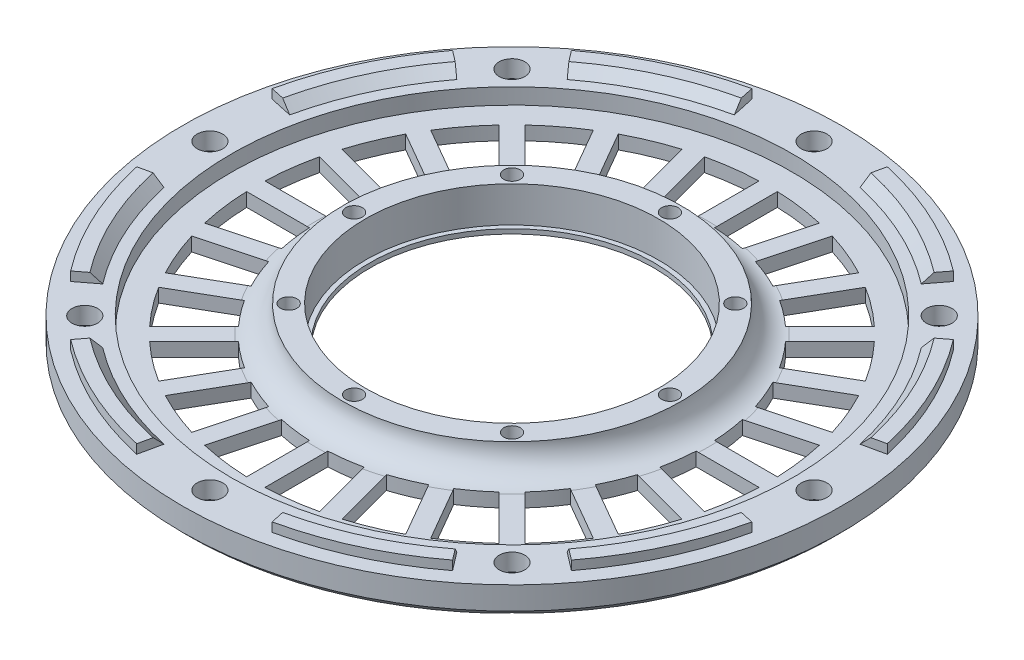
from build123d import *

# Parameters (mm, degrees)
SKETCH1_R                                         = 36
SKETCH1_R_2                                       = 16.025
BOSS_EXTRUDE1_DEPTH                               = 1
SKETCH2_R                                         = 18.5
SKETCH2_R_2                                       = 16.025
BOSS_EXTRUDE2_DEPTH                               = 3.9
FILLET1_R                                         = 2.9
BOSS_EXTRUDE3_START                               = -0.5
SKETCH4_R                                         = 36
SKETCH4_R_2                                       = 15.525
BOSS_EXTRUDE3_DEPTH                               = 0.5
CUT_EXTRUDE1_DEPTH                                = 51.994215358
CUT_EXTRUDE1_DEPTH_BACK                           = 51.994215358
SKETCH7_R                                         = 0.9
CUT_EXTRUDE2_DEPTH                                = 52.101467698
SKETCH8_R                                         = 36
SKETCH8_R_2                                       = 30.65
BOSS_EXTRUDE4_DEPTH                               = 1.7378
BOSS_EXTRUDE5_DEPTH                               = 1
CIRPATTERN1_COUNT                                 = 4
CHAMFER1_SIZE                                     = 1
CUT_EXTRUDE3_DEPTH                                = 52.014540569
CUT_EXTRUDE3_DEPTH_BACK                           = 52.014540569
SKETCH10_R                                        = 1.4
CHAMFER2_SIZE                                     = 0.75
CSK_FOR_M2_5_FLAT_HEAD_MACHINE_SCREW1_D           = 2.7
CSK_FOR_M2_5_FLAT_HEAD_MACHINE_SCREW1_CSINK_D     = 5.5
CSK_FOR_M2_5_FLAT_HEAD_MACHINE_SCREW1_CSINK_ANGLE = 90


with BuildPart() as part:
    # Sketch1 → Boss-Extrude1 (new body)
    with BuildSketch(Plane(origin=(0, 0, 0), x_dir=(1, 0, 0), z_dir=(0, 1, 0))):
        with Locations(Location((0, 0, 0), (0, 0, 270))):
            Circle(SKETCH1_R)
        with Locations(Location((0, 0, 0), (0, 0, 270))):
            Circle(SKETCH1_R_2, mode=Mode.SUBTRACT)
    extrude(amount=BOSS_EXTRUDE1_DEPTH)

    # Sketch2 → Boss-Extrude2 (add)
    with BuildSketch(Plane.XZ):
        with Locations(Location((0, 0, 0), (0, 0, 270))):
            Circle(SKETCH2_R)
        with Locations(Location((0, 0, 0), (0, 0, 90))):
            Circle(SKETCH2_R_2, mode=Mode.SUBTRACT)
    extrude(amount=-BOSS_EXTRUDE2_DEPTH)

    # Fillet1
    fillet1_edges = [part.edges().sort_by_distance(p)[0] for p in [
        (0, 1, 18.5),
    ]]
    fillet(fillet1_edges, radius=FILLET1_R - 0.0001)  # a hair under: the kernel refuses the full size

    # Sketch4 → Boss-Extrude3 (add)
    with BuildSketch(Plane(origin=(0, 0, 0), x_dir=(1, 0, 0), z_dir=(0, 1, 0)).offset(BOSS_EXTRUDE3_START)):
        with Locations(Location((0, 0, 0), (0, 0, 270))):
            Circle(SKETCH4_R)
        with Locations(Location((0, 0, 0), (0, 0, 270))):
            Circle(SKETCH4_R_2, mode=Mode.SUBTRACT)
    extrude(amount=BOSS_EXTRUDE3_DEPTH)

    # Sketch5 → Cut-Extrude1 (cut, two sides: drawn at the far end of the back side and taken through both)
    with BuildSketch(Plane(origin=(0, 1, 0), x_dir=(1, 0, 0), z_dir=(0, 1, 0)).offset(-CUT_EXTRUDE1_DEPTH_BACK)):
        with BuildLine():
            Line((27.989953555, 1), (21.126346111, 1))
            ThreePointArc((21.126346111, 1), (20.969058818, 2.760628965), (20.665302369, 4.501974901))
            Line((20.665302369, 4.501974901), (27.29503806, 6.278407225))
            ThreePointArc((27.29503806, 6.278407225), (27.768200701, 3.655752976), (27.989953555, 1))
        make_face()
        with BuildLine():
            Line((27.989953555, -1), (21.126346111, -1))
            ThreePointArc((21.126346111, -1), (20.969058818, -2.760628965), (20.665302369, -4.501974901))
            Line((20.665302369, -4.501974901), (27.29503806, -6.278407225))
            ThreePointArc((27.29503806, -6.278407225), (27.768200701, -3.655752976), (27.989953555, -1))
        make_face()
        with BuildLine():
            Line((26.77739997, -8.210258878), (20.147664279, -6.433826553))
            ThreePointArc((20.147664279, -6.433826553), (19.540052113, -8.093754595), (18.795952421, -9.697147652))
            Line((18.795952421, -9.697147652), (24.740010829, -13.128951374))
            ThreePointArc((24.740010829, -13.128951374), (25.875843712, -10.718125404), (26.77739997, -8.210258878))
        make_face()
        with BuildLine():
            Line((23.740010829, -14.861002181), (17.795952421, -11.429198459))
            ThreePointArc((17.795952421, -11.429198459), (16.779423147, -12.875304224), (15.645689378, -14.231475816))
            Line((15.645689378, -14.231475816), (20.498992745, -19.084779183))
            ThreePointArc((20.498992745, -19.084779183), (22.220090737, -17.050075298), (23.740010829, -14.861002181))
        make_face()
        with BuildLine():
            Line((19.084779183, -20.498992745), (14.231475816, -15.645689378))
            ThreePointArc((14.231475816, -15.645689378), (12.875304224, -16.779423147), (11.429198459, -17.795952421))
            Line((11.429198459, -17.795952421), (14.861002181, -23.740010829))
            ThreePointArc((14.861002181, -23.740010829), (17.050075298, -22.220090737), (19.084779183, -20.498992745))
        make_face()
        with BuildLine():
            Line((13.128951374, -24.740010829), (9.697147652, -18.795952421))
            ThreePointArc((9.697147652, -18.795952421), (8.093754595, -19.540052113), (6.433826553, -20.147664279))
            Line((6.433826553, -20.147664279), (8.210258878, -26.77739997))
            ThreePointArc((8.210258878, -26.77739997), (10.718125404, -25.875843712), (13.128951374, -24.740010829))
        make_face()
        with BuildLine():
            Line((6.278407225, -27.29503806), (4.501974901, -20.665302369))
            ThreePointArc((4.501974901, -20.665302369), (2.760628965, -20.969058818), (1, -21.126346111))
            Line((1, -21.126346111), (1, -27.989953555))
            ThreePointArc((1, -27.989953555), (3.655752976, -27.768200701), (6.278407225, -27.29503806))
        make_face()
        with BuildLine():
            Line((-1, -27.989953555), (-1, -21.126346111))
            ThreePointArc((-1, -21.126346111), (-2.760628965, -20.969058818), (-4.501974901, -20.665302369))
            Line((-4.501974901, -20.665302369), (-6.278407225, -27.29503806))
            ThreePointArc((-6.278407225, -27.29503806), (-3.655752976, -27.768200701), (-1, -27.989953555))
        make_face()
        with BuildLine():
            Line((-8.210258878, -26.77739997), (-6.433826553, -20.147664279))
            ThreePointArc((-6.433826553, -20.147664279), (-8.093754595, -19.540052113), (-9.697147652, -18.795952421))
            Line((-9.697147652, -18.795952421), (-13.128951374, -24.740010829))
            ThreePointArc((-13.128951374, -24.740010829), (-10.718125404, -25.875843712), (-8.210258878, -26.77739997))
        make_face()
        with BuildLine():
            Line((-14.861002181, -23.740010829), (-11.429198459, -17.795952421))
            ThreePointArc((-11.429198459, -17.795952421), (-12.875304224, -16.779423147), (-14.231475816, -15.645689378))
            Line((-14.231475816, -15.645689378), (-19.084779183, -20.498992745))
            ThreePointArc((-19.084779183, -20.498992745), (-17.050075298, -22.220090737), (-14.861002181, -23.740010829))
        make_face()
        with BuildLine():
            Line((-20.498992745, -19.084779183), (-15.645689378, -14.231475816))
            ThreePointArc((-15.645689378, -14.231475816), (-16.779423147, -12.875304224), (-17.795952421, -11.429198459))
            Line((-17.795952421, -11.429198459), (-23.740010829, -14.861002181))
            ThreePointArc((-23.740010829, -14.861002181), (-22.220090737, -17.050075298), (-20.498992745, -19.084779183))
        make_face()
        with BuildLine():
            Line((-24.740010829, -13.128951374), (-18.795952421, -9.697147652))
            ThreePointArc((-18.795952421, -9.697147652), (-19.540052113, -8.093754595), (-20.147664279, -6.433826553))
            Line((-20.147664279, -6.433826553), (-26.77739997, -8.210258878))
            ThreePointArc((-26.77739997, -8.210258878), (-25.875843712, -10.718125404), (-24.740010829, -13.128951374))
        make_face()
        with BuildLine():
            Line((-27.29503806, -6.278407225), (-20.665302369, -4.501974901))
            ThreePointArc((-20.665302369, -4.501974901), (-20.969058818, -2.760628965), (-21.126346111, -1))
            Line((-21.126346111, -1), (-27.989953555, -1))
            ThreePointArc((-27.989953555, -1), (-27.768200701, -3.655752976), (-27.29503806, -6.278407225))
        make_face()
        with BuildLine():
            Line((-27.989953555, 1), (-21.126346111, 1))
            ThreePointArc((-21.126346111, 1), (-20.969058818, 2.760628965), (-20.665302369, 4.501974901))
            Line((-20.665302369, 4.501974901), (-27.29503806, 6.278407225))
            ThreePointArc((-27.29503806, 6.278407225), (-27.768200701, 3.655752976), (-27.989953555, 1))
        make_face()
        with BuildLine():
            Line((-26.77739997, 8.210258878), (-20.147664279, 6.433826553))
            ThreePointArc((-20.147664279, 6.433826553), (-19.540052113, 8.093754595), (-18.795952421, 9.697147652))
            Line((-18.795952421, 9.697147652), (-24.740010829, 13.128951374))
            ThreePointArc((-24.740010829, 13.128951374), (-25.875843712, 10.718125404), (-26.77739997, 8.210258878))
        make_face()
        with BuildLine():
            Line((-23.740010829, 14.861002181), (-17.795952421, 11.429198459))
            ThreePointArc((-17.795952421, 11.429198459), (-16.779423147, 12.875304224), (-15.645689378, 14.231475816))
            Line((-15.645689378, 14.231475816), (-20.498992745, 19.084779183))
            ThreePointArc((-20.498992745, 19.084779183), (-22.220090737, 17.050075298), (-23.740010829, 14.861002181))
        make_face()
        with BuildLine():
            Line((-19.084779183, 20.498992745), (-14.231475816, 15.645689378))
            ThreePointArc((-14.231475816, 15.645689378), (-12.875304224, 16.779423147), (-11.429198459, 17.795952421))
            Line((-11.429198459, 17.795952421), (-14.861002181, 23.740010829))
            ThreePointArc((-14.861002181, 23.740010829), (-17.050075298, 22.220090737), (-19.084779183, 20.498992745))
        make_face()
        with BuildLine():
            Line((-13.128951374, 24.740010829), (-9.697147652, 18.795952421))
            ThreePointArc((-9.697147652, 18.795952421), (-8.093754595, 19.540052113), (-6.433826553, 20.147664279))
            Line((-6.433826553, 20.147664279), (-8.210258878, 26.77739997))
            ThreePointArc((-8.210258878, 26.77739997), (-10.718125404, 25.875843712), (-13.128951374, 24.740010829))
        make_face()
        with BuildLine():
            Line((-6.278407225, 27.29503806), (-4.501974901, 20.665302369))
            ThreePointArc((-4.501974901, 20.665302369), (-2.760628965, 20.969058818), (-1, 21.126346111))
            Line((-1, 21.126346111), (-1, 27.989953555))
            ThreePointArc((-1, 27.989953555), (-3.655752976, 27.768200701), (-6.278407225, 27.29503806))
        make_face()
        with BuildLine():
            Line((1, 27.989953555), (1, 21.126346111))
            ThreePointArc((1, 21.126346111), (2.760628965, 20.969058818), (4.501974901, 20.665302369))
            Line((4.501974901, 20.665302369), (6.278407225, 27.29503806))
            ThreePointArc((6.278407225, 27.29503806), (3.655752976, 27.768200701), (1, 27.989953555))
        make_face()
        with BuildLine():
            Line((8.210258878, 26.77739997), (6.433826553, 20.147664279))
            ThreePointArc((6.433826553, 20.147664279), (8.093754595, 19.540052113), (9.697147652, 18.795952421))
            Line((9.697147652, 18.795952421), (13.128951374, 24.740010829))
            ThreePointArc((13.128951374, 24.740010829), (10.718125404, 25.875843712), (8.210258878, 26.77739997))
        make_face()
        with BuildLine():
            Line((14.861002181, 23.740010829), (11.429198459, 17.795952421))
            ThreePointArc((11.429198459, 17.795952421), (12.875304224, 16.779423147), (14.231475816, 15.645689378))
            Line((14.231475816, 15.645689378), (19.084779183, 20.498992745))
            ThreePointArc((19.084779183, 20.498992745), (17.050075298, 22.220090737), (14.861002181, 23.740010829))
        make_face()
        with BuildLine():
            Line((20.498992745, 19.084779183), (15.645689378, 14.231475816))
            ThreePointArc((15.645689378, 14.231475816), (16.779423147, 12.875304224), (17.795952421, 11.429198459))
            Line((17.795952421, 11.429198459), (23.740010829, 14.861002181))
            ThreePointArc((23.740010829, 14.861002181), (22.220090737, 17.050075298), (20.498992745, 19.084779183))
        make_face()
        with BuildLine():
            Line((24.740010829, 13.128951374), (18.795952421, 9.697147652))
            ThreePointArc((18.795952421, 9.697147652), (19.540052113, 8.093754595), (20.147664279, 6.433826553))
            Line((20.147664279, 6.433826553), (26.77739997, 8.210258878))
            ThreePointArc((26.77739997, 8.210258878), (25.875843712, 10.718125404), (24.740010829, 13.128951374))
        make_face()
    extrude(amount=CUT_EXTRUDE1_DEPTH + CUT_EXTRUDE1_DEPTH_BACK, mode=Mode.SUBTRACT)

    # Sketch7 → Cut-Extrude2 (cut, through all)
    with BuildSketch(Plane(origin=(0, 3.9, 0), x_dir=(1, 0, 0), z_dir=(0, 1, 0))):
        with Locations(Location((0, 17.25, 0), (0, 0, 270))):
            Circle(SKETCH7_R)
        with Locations(Location((12.197591975, 12.197591975, 0), (0, 0, 270))):
            Circle(SKETCH7_R)
        with Locations(Location((17.25, 0, 0), (0, 0, 270))):
            Circle(SKETCH7_R)
        with Locations(Location((12.197591975, -12.197591975, 0), (0, 0, 270))):
            Circle(SKETCH7_R)
        with Locations(Location((0, -17.25, 0), (0, 0, 270))):
            Circle(SKETCH7_R)
        with Locations(Location((-12.197591975, -12.197591975, 0), (0, 0, 270))):
            Circle(SKETCH7_R)
        with Locations(Location((-17.25, 0, 0), (0, 0, 270))):
            Circle(SKETCH7_R)
        with Locations(Location((-12.197591975, 12.197591975, 0), (0, 0, 270))):
            Circle(SKETCH7_R)
    extrude(amount=-CUT_EXTRUDE2_DEPTH, mode=Mode.SUBTRACT)

    # Sketch8 → Boss-Extrude4 (add)
    with BuildSketch(Plane(origin=(0, 1, 0), x_dir=(1, 0, 0), z_dir=(0, 1, 0))):
        with Locations(Location((0, 0, 0), (0, 0, 270))):
            Circle(SKETCH8_R)
        with Locations(Location((0, 0, 0), (0, 0, 270))):
            Circle(SKETCH8_R_2, mode=Mode.SUBTRACT)
    extrude(amount=BOSS_EXTRUDE4_DEPTH)

    # Sketch9 → Boss-Extrude5 (add)
    with BuildSketch(Plane(origin=(0, 2.7378, 0), x_dir=(1, 0, 0), z_dir=(0, 1, 0))):
        with BuildLine():
            Line((-27.352115736, 20.861969341), (-25.368732385, 19.340065768))
            ThreePointArc((-25.368732385, 19.340065768), (-28.940572033, 13.418420813), (-31.152312489, 6.866160013))
            Line((-31.152312489, 6.866160013), (-33.595390255, 7.396604193))
            ThreePointArc((-33.595390255, 7.396604193), (-31.208630798, 14.470016024), (-27.352115736, 20.861969341))
        make_face()
        with BuildLine():
            Line((-7.396604193, 33.595390255), (-6.866160013, 31.152312489))
            ThreePointArc((-6.866160013, 31.152312489), (-13.418420813, 28.940572033), (-19.340065768, 25.368732385))
            Line((-19.340065768, 25.368732385), (-20.861969341, 27.352115736))
            ThreePointArc((-20.861969341, 27.352115736), (-14.470016024, 31.208630798), (-7.396604193, 33.595390255))
        make_face()
    boss_extrude5 = extrude(amount=BOSS_EXTRUDE5_DEPTH)

    # CirPattern1: Boss-Extrude5 ×4 about axis
    cirpattern1_axis = Axis((0, 0, 0), (0, 1, 0))
    for i in range(1, CIRPATTERN1_COUNT):
        add(boss_extrude5.rotate(cirpattern1_axis, i * 360 / CIRPATTERN1_COUNT))

    # Chamfer1
    chamfer1_edges = [part.edges().sort_by_distance(p)[0] for p in [
        (-28.940572033, 3.7378, -13.418420813),
        (-13.418420813, 3.7378, -28.940572033),
        (13.418420813, 3.7378, -28.940572033),
        (28.940572033, 3.7378, -13.418420813),
        (28.940572033, 3.7378, 13.418420813),
        (13.418420813, 3.7378, 28.940572033),
        (-13.418420813, 3.7378, 28.940572033),
        (-28.940572033, 3.7378, 13.418420813),
    ]]
    chamfer(chamfer1_edges, length=CHAMFER1_SIZE - 0.0001)  # a hair under: the kernel refuses the full size

    # Sketch10 → Cut-Extrude3 (cut, two sides: drawn at the far end of the back side and taken through both)
    with BuildSketch(Plane(origin=(0, 2.7378, 0), x_dir=(1, 0, 0), z_dir=(0, 1, 0)).offset(-CUT_EXTRUDE3_DEPTH_BACK)):
        with Locations(Location((0, 33, 0), (0, 0, 270))):
            Circle(SKETCH10_R)
        with Locations(Location((23.334523779, 23.334523779, 0), (0, 0, 270))):
            Circle(SKETCH10_R)
        with Locations(Location((33, 0, 0), (0, 0, 270))):
            Circle(SKETCH10_R)
        with Locations(Location((23.334523779, -23.334523779, 0), (0, 0, 270))):
            Circle(SKETCH10_R)
        with Locations(Location((0, -33, 0), (0, 0, 270))):
            Circle(SKETCH10_R)
        with Locations(Location((-23.334523779, -23.334523779, 0), (0, 0, 270))):
            Circle(SKETCH10_R)
        with Locations(Location((-33, 0, 0), (0, 0, 270))):
            Circle(SKETCH10_R)
        with Locations(Location((-23.334523779, 23.334523779, 0), (0, 0, 270))):
            Circle(SKETCH10_R)
    extrude(amount=CUT_EXTRUDE3_DEPTH + CUT_EXTRUDE3_DEPTH_BACK, mode=Mode.SUBTRACT)

    # Chamfer2
    chamfer2_edges = [part.edges().sort_by_distance(p)[0] for p in [
        (0, -0.5, -36),
    ]]
    chamfer(chamfer2_edges, length=CHAMFER2_SIZE)

    # CSK for M2.5 Flat Head Machine Screw1 (through all)
    with Locations(Plane(origin=(0, -0.5, 0), x_dir=(-1, 0, 0), z_dir=(0, -1, 0))):
        with Locations((0, -33), (23.334523779, -23.334523779), (33, 0), (23.334523779, 23.334523779), (0, 33), (-23.334523779, 23.334523779), (-33, 0), (-23.334523779, -23.334523779)):
            CounterSinkHole(CSK_FOR_M2_5_FLAT_HEAD_MACHINE_SCREW1_D / 2, CSK_FOR_M2_5_FLAT_HEAD_MACHINE_SCREW1_CSINK_D / 2, counter_sink_angle=CSK_FOR_M2_5_FLAT_HEAD_MACHINE_SCREW1_CSINK_ANGLE)


solid = part.part
